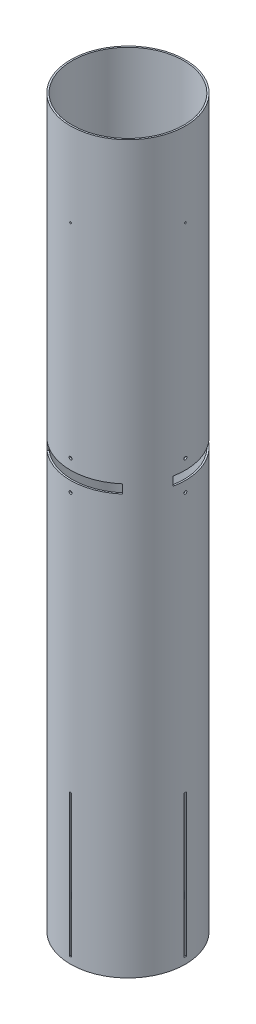
from build123d import *

# Parameters (mm, degrees)
SKETCH1_R                 = 78.359
SKETCH1_R_2               = 76.2
BOSS_EXTRUDE1_DEPTH       = 990.6
FIN_SLOTS_DEPTH           = 997.779125866
CIRPATTERN1_COUNT         = 4
CUT_EXTRUDE2_DEPTH        = 997.779125866
CIRPATTERN2_COUNT         = 4
SKETCH3_R                 = 3.175
CUT_EXTRUDE3_DEPTH        = 997.779125982
CUT_EXTRUDE4_START        = -12.065
CUT_EXTRUDE4_DEPTH        = 12.065
CIRPATTERN3_COUNT         = 3
SKETCH2_4_R               = 1.0922
SHEAR_SCREW_HOLES_DEPTH   = 997.779125982
SHEAR_SCREW_PATTERN_COUNT = 4
LPATTERN1_COUNT           = 2
LPATTERN1_PITCH           = 40.57396
LPATTERN1_COPY_1_DEPTH    = 997.779125866
LPATTERN1_COPY_2_DEPTH    = 997.779125866
LPATTERN1_COPY_3_DEPTH    = 997.779125866


with BuildPart() as part:
    # Sketch1 → Boss-Extrude1 (new body)
    with BuildSketch(Plane(origin=(0, 0, 0), x_dir=(1, 0, 0), z_dir=(0, 1, 0))):
        Circle(SKETCH1_R)
        Circle(SKETCH1_R_2, mode=Mode.SUBTRACT)
    extrude(amount=BOSS_EXTRUDE1_DEPTH)

    # Sketch2 → Fin Slots (cut, through all)
    with BuildSketch(Plane(origin=(0, 0, 0), x_dir=(0, 0, -1), z_dir=(1, 0, 0))):
        Polygon((0, 8.89), (1.5875, 8.89), (1.5875, 203.2), (-1.5875, 203.2), (-1.5875, 8.89), align=None)
    fin_slots = extrude(amount=-FIN_SLOTS_DEPTH, mode=Mode.SUBTRACT)

    # CirPattern1: Fin Slots ×4 about axis
    cirpattern1_axis = Axis((0, 0, 0), (0, 1, 0))
    for i in range(1, CIRPATTERN1_COUNT):
        add(fin_slots.rotate(cirpattern1_axis, i * 360 / CIRPATTERN1_COUNT), mode=Mode.SUBTRACT)

    # Sketch2<3> → Cut-Extrude2 (cut, through all)
    with BuildSketch(Plane(origin=(0, 0, 0), x_dir=(0, 0, -1), z_dir=(1, 0, 0))):
        with BuildLine():
            ThreePointArc((1.999996, 598.17), (1.414210734, 599.584210734), (0, 600.169996))
            ThreePointArc((0, 600.169996), (-1.414210734, 596.755789266), (1.999996, 598.17))
        make_face()
    cut_extrude2 = extrude(amount=-CUT_EXTRUDE2_DEPTH, mode=Mode.SUBTRACT)

    # CirPattern2: Cut-Extrude2 ×4 about axis
    cirpattern2_axis = Axis((0, 990.6, 0), (0, -1, 0))
    for i in range(1, CIRPATTERN2_COUNT):
        add(cut_extrude2.rotate(cirpattern2_axis, i * 360 / CIRPATTERN2_COUNT), mode=Mode.SUBTRACT)

    # Sketch3 → Cut-Extrude3 (cut, through all)
    with BuildSketch(Plane(origin=(0, 0, 0), x_dir=(0.7071067811865477, 0, -0.7071067811865475), z_dir=(0.7071067811865475, 0, 0.7071067811865477))):
        with Locations((0, 127)):
            Circle(SKETCH3_R)
    extrude(amount=-CUT_EXTRUDE3_DEPTH, mode=Mode.SUBTRACT)

    # Sketch7 → Cut-Extrude4 (cut)
    with BuildSketch(Plane(origin=(0, 583.8825, 0), x_dir=(1, 0, 0), z_dir=(0, 1, 0)).offset(CUT_EXTRUDE4_START)):
        with BuildLine():
            Line((-76.853353787, -15.287082543), (-74.735838367, -14.865882538))
            ThreePointArc((-74.735838367, -14.865882538), (-65.991135768, 38.1), (-24.493687256, 72.156075868))
            Line((-24.493687256, 72.156075868), (-25.187675062, 74.200498017))
            ThreePointArc((-25.187675062, 74.200498017), (-63.106141662, 46.451563651), (-78.333472392, 1.999996))
            ThreePointArc((-78.333472392, 1.999996), (-78.359, 0), (-78.333472392, -1.999996))
            ThreePointArc((-78.333472392, -1.999996), (-77.877303639, -8.675163336), (-76.853353787, -15.287082543))
        make_face()
    cut_extrude4 = extrude(amount=CUT_EXTRUDE4_DEPTH, mode=Mode.SUBTRACT)

    # CirPattern3: Cut-Extrude4 ×3 about axis
    cirpattern3_axis = Axis((0, 990.6, 0), (0, -1, 0))
    for i in range(1, CIRPATTERN3_COUNT):
        add(cut_extrude4.rotate(cirpattern3_axis, i * 360 / CIRPATTERN3_COUNT), mode=Mode.SUBTRACT)

    # Sketch2<4> → Shear Screw Holes (cut, through all)
    with BuildSketch(Plane(origin=(0, 0, 0), x_dir=(0, 0, -1), z_dir=(1, 0, 0))):
        with Locations((0, 876.3)):
            Circle(SKETCH2_4_R)
    shear_screw_holes = extrude(amount=-SHEAR_SCREW_HOLES_DEPTH, mode=Mode.SUBTRACT)

    # Shear Screw Pattern: Shear Screw Holes ×4 about axis
    shear_screw_pattern_axis = Axis((0, 990.6, 0), (0, -1, 0))
    for i in range(1, SHEAR_SCREW_PATTERN_COUNT):
        add(shear_screw_holes.rotate(shear_screw_pattern_axis, i * 360 / SHEAR_SCREW_PATTERN_COUNT), mode=Mode.SUBTRACT)

    # LPattern1: Cut-Extrude2 ×2
    with Locations(*[(0, -i * LPATTERN1_PITCH, 0) for i in range(1, LPATTERN1_COUNT)]):
        add(cut_extrude2, mode=Mode.SUBTRACT)

    # LPattern1 copy 1 sketch → LPattern1 copy 1 (cut, through all)
    with BuildSketch(Plane(origin=(0, -40.57396, 0), x_dir=(1, 0, 0), z_dir=(0, 0, 1))):
        with BuildLine():
            ThreePointArc((1.999996, 598.17), (1.414210734, 599.584210734), (0, 600.169996))
            ThreePointArc((0, 600.169996), (-1.414210734, 596.755789266), (1.999996, 598.17))
        make_face()
    extrude(amount=-LPATTERN1_COPY_1_DEPTH, mode=Mode.SUBTRACT)

    # LPattern1 copy 2 sketch → LPattern1 copy 2 (cut, through all)
    with BuildSketch(Plane(origin=(0, -40.57396, 0), x_dir=(0, 0, 1), z_dir=(-1, 0, 0))):
        with BuildLine():
            ThreePointArc((1.999996, 598.17), (1.414210734, 599.584210734), (0, 600.169996))
            ThreePointArc((0, 600.169996), (-1.414210734, 596.755789266), (1.999996, 598.17))
        make_face()
    extrude(amount=-LPATTERN1_COPY_2_DEPTH, mode=Mode.SUBTRACT)

    # LPattern1 copy 3 sketch → LPattern1 copy 3 (cut, through all)
    with BuildSketch(Plane(origin=(0, -40.57396, 0), x_dir=(-1, 0, 0), z_dir=(0, 0, -1))):
        with BuildLine():
            ThreePointArc((1.999996, 598.17), (1.414210734, 599.584210734), (0, 600.169996))
            ThreePointArc((0, 600.169996), (-1.414210734, 596.755789266), (1.999996, 598.17))
        make_face()
    extrude(amount=-LPATTERN1_COPY_3_DEPTH, mode=Mode.SUBTRACT)


solid = part.part
